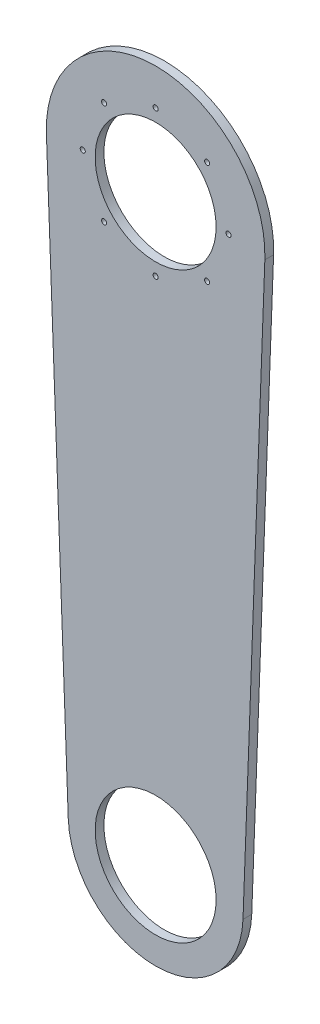
from build123d import *

# Parameters (mm, degrees)
SKETCH_1_R          = 41.5
EXTRUDE_1_DEPTH     = 6
SKETCH_2_R          = 1.75
CUT_EXTRUDE_1_DEPTH = 10


with BuildPart() as part:
    # 草图1 → 凸台-拉伸1 (new body)
    with BuildSketch(Plane.XY):
        with BuildLine():
            ThreePointArc((74.947247073, -2.8125), (0, 75), (-74.947247073, -2.8125))
            Line((-74.947247073, -2.8125), (-59.957797658, -402.25))
            ThreePointArc((-59.957797658, -402.25), (0, -460), (59.957797658, -402.25))
            Line((59.957797658, -402.25), (74.947247073, -2.8125))
        make_face()
        with Locations((0, -400)):
            Circle(SKETCH_1_R, mode=Mode.SUBTRACT)
        Circle(SKETCH_1_R, mode=Mode.SUBTRACT)
    extrude(amount=EXTRUDE_1_DEPTH)

    # 草图2 → 切除-拉伸1 (cut)
    with BuildSketch(Plane.XY.offset(6)):
        with Locations((50, 0)):
            Circle(SKETCH_2_R)
        with Locations((35.355339059, -35.355339059)):
            Circle(SKETCH_2_R)
        with Locations((0, -50)):
            Circle(SKETCH_2_R)
        with Locations((-35.355339059, -35.355339059)):
            Circle(SKETCH_2_R)
        with Locations((-50, 0)):
            Circle(SKETCH_2_R)
        with Locations((-35.355339059, 35.355339059)):
            Circle(SKETCH_2_R)
        with Locations((0, 50)):
            Circle(SKETCH_2_R)
        with Locations((35.355339059, 35.355339059)):
            Circle(SKETCH_2_R)
    extrude(amount=-CUT_EXTRUDE_1_DEPTH, mode=Mode.SUBTRACT)


solid = part.part
